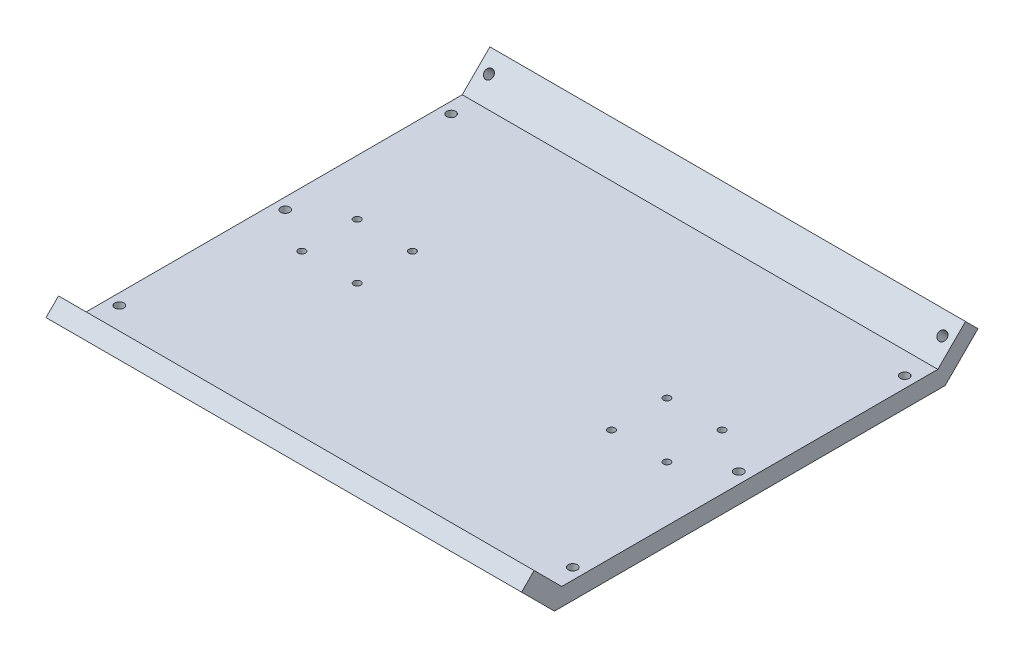
from build123d import *

# Parameters (mm, degrees)
MAIN_DEPTH                      = 107.5
F_4_0MM_DOWEL_HOLE1_D           = 4.1
F_4_0MM_DOWEL_HOLE1_ON_FACE_2_D = 4.1
F_4_0MM_DOWEL_HOLE1_ON_FACE_3_D = 4.1
F_4_0MM_DOWEL_HOLE1_ON_FACE_4_D = 4.1
SKETCH4_R                       = 1.6
ATTACHMENT_SCREW_HOLES_DEPTH    = 151.392275662


with BuildPart() as part:
    # Sketch2 → Main (new, symmetric)
    with BuildSketch(Plane(origin=(0, 0, 0), x_dir=(0, 0, -1), z_dir=(1, 0, 0))):
        Polygon((-85, 0), (85, 0), (97.5, 12.5), (103.156854249, 6.843145751), (88.313708499, -8), (-88.313708499, -8), (-103.156854249, 6.843145751), (-97.5, 12.5), align=None)
    extrude(amount=MAIN_DEPTH, both=True)

    # Ø4.0mm Dowel Hole1 (through all)
    with Locations(Plane(origin=(-102.5, 7.071067812, -92.071067812), x_dir=(0, 0.707106781187, -0.707106781187), z_dir=(0, 0.707106781187, 0.707106781187))):
        with Locations((0, 0)):
            Hole(F_4_0MM_DOWEL_HOLE1_D / 2)

    # Ø4.0mm Dowel Hole1 on face 2 (through all)
    with Locations(Plane(origin=(-102.5, 0, -75), x_dir=(0, 0, 1), z_dir=(0, 1, 0))):
        with Locations((0, 0), (75, 0), (150, 0), (150, 205), (75, 205), (0, 205)):
            Hole(F_4_0MM_DOWEL_HOLE1_ON_FACE_2_D / 2)

    # Ø4.0mm Dowel Hole1 on face 3 (through all)
    with Locations(Plane(origin=(-102.5, 7.071067812, 92.071067812), x_dir=(0, -0.707106781187, -0.707106781187), z_dir=(0, 0.707106781187, -0.707106781187))):
        with Locations((0, 0), (0, -205)):
            Hole(F_4_0MM_DOWEL_HOLE1_ON_FACE_3_D / 2)

    # Ø4.0mm Dowel Hole1 on face 4 (through all)
    with Locations(Plane(origin=(102.5, 7.071067812, -92.071067812), x_dir=(0, 0.707106781187, -0.707106781187), z_dir=(0, 0.707106781187, 0.707106781187))):
        with Locations((0, 0)):
            Hole(F_4_0MM_DOWEL_HOLE1_ON_FACE_4_D / 2)

    # Sketch4 → Attachment screw holes (cut, through all)
    with BuildSketch(Plane.XZ.offset(8)):
        with Locations((57.5, 12.5)):
            Circle(SKETCH4_R)
        with Locations((82.5, 12.5)):
            Circle(SKETCH4_R)
        with Locations((82.5, -12.5)):
            Circle(SKETCH4_R)
        with Locations((57.5, -12.5)):
            Circle(SKETCH4_R)
    attachment_screw_holes = extrude(amount=-ATTACHMENT_SCREW_HOLES_DEPTH, mode=Mode.SUBTRACT)

    # Mirror1: Attachment screw holes across plane
    add(attachment_screw_holes.mirror(Plane(origin=(0, 0, 0), x_dir=(0, 0, 1), z_dir=(1, 0, 0))), mode=Mode.SUBTRACT)


solid = part.part
